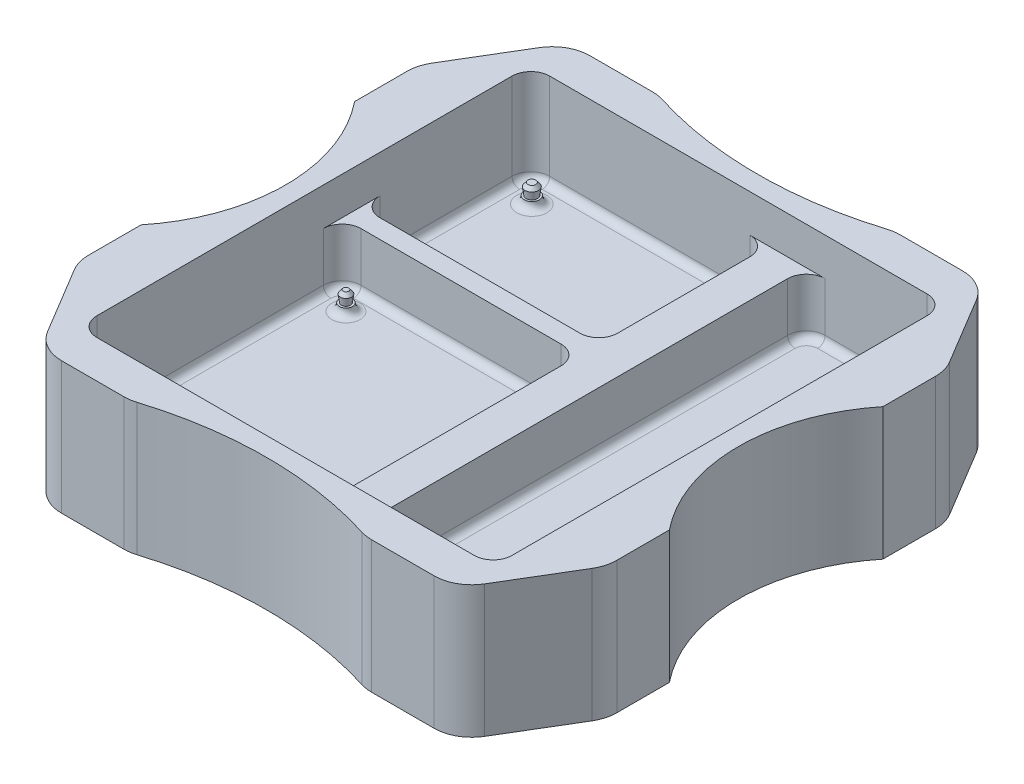
from build123d import *
from OCP.BRepFilletAPI import BRepFilletAPI_MakeChamfer

# Parameters (mm, degrees)
SKETCH1_W                     = 140
SKETCH1_H                     = 140
BOSS_EXTRUDE1_DEPTH           = 40
SHELL3_T                      = -10
SKETCH3_W                     = 5
SKETCH3_H                     = 120
BOSS_EXTRUDE2_DEPTH           = 30
CUT_EXTRUDE1_DEPTH            = 40
FILLET1_R                     = 10
SKETCH5_R                     = 45
SKETCH5_R_2                   = 100
CUT_EXTRUDE4_DEPTH            = 40
FILLET2_R                     = 10
SKETCH6_W                     = 63
SKETCH6_H                     = 5
BOSS_EXTRUDE3_DEPTH           = 15
FILLET4_R                     = 5
SKETCH7_R                     = 1.75
SKETCH7_R_2                   = 2
BOSS_EXTRUDE4_DEPTH           = 2
SKETCH8_R                     = 1.5
BOSS_EXTRUDE5_DEPTH           = 3
BOSS_EXTRUDE5_DRAFT           = -8
BOSS_EXTRUDE5_PROFILE_2_DEPTH = 3
BOSS_EXTRUDE5_PROFILE_2_DRAFT = -8
SKETCH8_R_2                   = 1.2
BOSS_EXTRUDE5_PROFILE_3_DEPTH = 3
BOSS_EXTRUDE5_PROFILE_3_DRAFT = -8
BOSS_EXTRUDE5_PROFILE_4_DEPTH = 3
BOSS_EXTRUDE5_PROFILE_4_DRAFT = -8
BOSS_EXTRUDE5_PROFILE_5_DEPTH = 3
BOSS_EXTRUDE5_PROFILE_5_DRAFT = -8
BOSS_EXTRUDE5_PROFILE_6_DEPTH = 3
BOSS_EXTRUDE5_PROFILE_6_DRAFT = -8
CHAMFER1_SIZE                 = 1
CHAMFER1_SIZE2                = 0.885393615
FILLET7_R                     = 2
CUT_EXTRUDE5_DEPTH            = 5


with BuildPart() as part:
    # Sketch1 → Boss-Extrude1 (new body)
    with BuildSketch(Plane(origin=(0, 0, 0), x_dir=(1, 0, 0), z_dir=(0, 1, 0))):
        with Locations((4.2, -21)):
            Rectangle(SKETCH1_W, SKETCH1_H)
    extrude(amount=BOSS_EXTRUDE1_DEPTH)

    # Shell3
    shell3_openings = [part.faces().sort_by_distance(p)[0] for p in [
        (4.2, 40, 21),
    ]]
    offset(amount=SHELL3_T, openings=shell3_openings, kind=Kind.INTERSECTION)

    # Sketch3 → Boss-Extrude2 (add)
    with BuildSketch(Plane(origin=(0, 10, 0), x_dir=(1, 0, 0), z_dir=(0, 1, 0))):
        with Locations((-53.3, -21)):
            Rectangle(SKETCH3_W, SKETCH3_H)
        with Locations((61.7, -21)):
            Rectangle(SKETCH3_W, SKETCH3_H)
    extrude(amount=BOSS_EXTRUDE2_DEPTH)

    # Sketch4 → Cut-Extrude1 (cut)
    with BuildSketch(Plane(origin=(0, 40, 0), x_dir=(1, 0, 0), z_dir=(0, 1, 0))):
        Polygon((-65.8, 24), (-50.8, 49), (-65.8, 49), align=None)
        Polygon((59.2, 49), (74.2, 49), (74.2, 24), align=None)
        Polygon((74.2, -91), (74.2, -66), (59.2, -91), align=None)
        Polygon((-65.8, -66), (-50.8, -91), (-65.8, -91), align=None)
    extrude(amount=-CUT_EXTRUDE1_DEPTH, mode=Mode.SUBTRACT)

    # Fillet1
    fillet1_edges = [part.edges().sort_by_distance(p)[0] for p in [
        (-65.8, 20, -24),
        (-50.8, 20, -49),
        (74.2, 20, -24),
        (59.2, 20, -49),
        (59.2, 20, 91),
        (74.2, 20, 66),
        (-65.8, 20, 66),
        (-50.8, 20, 91),
    ]]
    fillet(fillet1_edges, radius=FILLET1_R)

    # Sketch5 → Cut-Extrude4 (cut)
    with BuildSketch(Plane(origin=(0, 40, 0), x_dir=(1, 0, 0), z_dir=(0, 1, 0))):
        with Locations((-100.8, -21)):
            Circle(SKETCH5_R)
        with Locations((109.2, -21)):
            Circle(SKETCH5_R)
        with Locations((4.2, 144)):
            Circle(SKETCH5_R_2)
        with Locations((4.2, -186)):
            Circle(SKETCH5_R_2)
    extrude(amount=-CUT_EXTRUDE4_DEPTH, mode=Mode.SUBTRACT)

    # Fillet2
    fillet2_edges = [part.edges().sort_by_distance(p)[0] for p in [
        (35.424989992, 20, -49),
        (-27.024989992, 20, -49),
        (-27.024989992, 20, 91),
        (35.424989992, 20, 91),
    ]]
    fillet(fillet2_edges, radius=FILLET2_R)

    # Sketch6 → Boss-Extrude3 (add)
    with BuildSketch(Plane(origin=(0, 10, 0), x_dir=(1, 0, 0), z_dir=(0, 1, 0))):
        with Locations((-19.3, -8.5)):
            Rectangle(SKETCH6_W, SKETCH6_H)
        Polygon((12.2, 39), (12.2, -6), (12.2, -11), (12.2, -81), (22.2, -81), (22.2, 39), align=None)
    extrude(amount=BOSS_EXTRUDE3_DEPTH)

    # Fillet4
    fillet4_edges = [part.edges().sort_by_distance(p)[0] for p in [
        (-50.8, 17.5, 11),
        (12.2, 17.5, 11),
        (12.2, 17.5, 81),
        (22.2, 17.5, 81),
        (22.2, 17.5, -39),
        (12.2, 17.5, -39),
        (12.2, 17.5, 6),
        (-50.8, 17.5, 6),
        (-50.8, 25, 81),
        (-50.8, 25, -39),
        (59.2, 25, -39),
        (59.2, 25, 81),
    ]]
    fillet(fillet4_edges, radius=FILLET4_R)

    # Sketch7 → Boss-Extrude4 (add)
    with BuildSketch(Plane(origin=(0, 10, 0), x_dir=(1, 0, 0), z_dir=(0, 1, 0))):
        with Locations(Location((-43.8, -75, 0), (0, 0, 270))):
            Circle(SKETCH7_R)
        with Locations(Location((5.2, -75, 0), (0, 0, 270))):
            Circle(SKETCH7_R)
        with Locations(Location((-43.8, -17, 0), (0, 0, 270))):
            Circle(SKETCH7_R)
        with Locations(Location((5.2, -16, 0), (0, 0, 270))):
            Circle(SKETCH7_R)
        with Locations(Location((-43.8, 0.75, 0), (0, 0, 270))):
            Circle(SKETCH7_R_2)
        with Locations(Location((-43.8, 32.25, 0), (0, 0, 270))):
            Circle(SKETCH7_R_2)
    extrude(amount=BOSS_EXTRUDE4_DEPTH)


with BuildPart() as boss_extrude5_tool:
    # Sketch8 → Boss-Extrude5 (with draft: the straight prism first)
    with BuildSketch(Plane(origin=(0, 12, 0), x_dir=(1, 0, 0), z_dir=(0, 1, 0))):
        with Locations((-43.8, 32.25)):
            Circle(SKETCH8_R)
    extrude(amount=BOSS_EXTRUDE5_DEPTH)
    # Boss-Extrude5: the draft: its side faces are tilted about the plane it starts from
    boss_extrude5_sides = [boss_extrude5_tool.faces().sort_by_distance(p)[0] for p in [
        (-45.3, 13.5, -32.25),
    ]]
    draft(boss_extrude5_sides, Plane(origin=(0, 12, 0), x_dir=(1, 0, 0), z_dir=(0, 1, 0)), BOSS_EXTRUDE5_DRAFT)


with BuildPart() as part_1:
    add(part.part)

    # Boss-Extrude5: add boss_extrude5_tool
    add(boss_extrude5_tool.part)


with BuildPart() as boss_extrude5_profile_2_tool:
    # Sketch8 → Boss-Extrude5 profile 2 (with draft: the straight prism first)
    with BuildSketch(Plane(origin=(0, 12, 0), x_dir=(1, 0, 0), z_dir=(0, 1, 0))):
        with Locations((-43.8, 0.75)):
            Circle(SKETCH8_R)
    extrude(amount=BOSS_EXTRUDE5_PROFILE_2_DEPTH)
    # Boss-Extrude5 profile 2: the draft: its side faces are tilted about the plane it starts from
    boss_extrude5_profile_2_sides = [boss_extrude5_profile_2_tool.faces().sort_by_distance(p)[0] for p in [
        (-45.3, 13.5, -0.75),
    ]]
    draft(boss_extrude5_profile_2_sides, Plane(origin=(0, 12, 0), x_dir=(1, 0, 0), z_dir=(0, 1, 0)), BOSS_EXTRUDE5_PROFILE_2_DRAFT)


with BuildPart() as part_2:
    add(part_1.part)

    # Boss-Extrude5 profile 2: add boss_extrude5_profile_2_tool
    add(boss_extrude5_profile_2_tool.part)


with BuildPart() as boss_extrude5_profile_3_tool:
    # Sketch8 → Boss-Extrude5 profile 3 (with draft: the straight prism first)
    with BuildSketch(Plane(origin=(0, 12, 0), x_dir=(1, 0, 0), z_dir=(0, 1, 0))):
        with Locations((-43.8, -17)):
            Circle(SKETCH8_R_2)
    extrude(amount=BOSS_EXTRUDE5_PROFILE_3_DEPTH)
    # Boss-Extrude5 profile 3: the draft: its side faces are tilted about the plane it starts from
    boss_extrude5_profile_3_sides = [boss_extrude5_profile_3_tool.faces().sort_by_distance(p)[0] for p in [
        (-45, 13.5, 17),
    ]]
    draft(boss_extrude5_profile_3_sides, Plane(origin=(0, 12, 0), x_dir=(1, 0, 0), z_dir=(0, 1, 0)), BOSS_EXTRUDE5_PROFILE_3_DRAFT)


with BuildPart() as part_3:
    add(part_2.part)

    # Boss-Extrude5 profile 3: add boss_extrude5_profile_3_tool
    add(boss_extrude5_profile_3_tool.part)


with BuildPart() as boss_extrude5_profile_4_tool:
    # Sketch8 → Boss-Extrude5 profile 4 (with draft: the straight prism first)
    with BuildSketch(Plane(origin=(0, 12, 0), x_dir=(1, 0, 0), z_dir=(0, 1, 0))):
        with Locations((5.2, -16)):
            Circle(SKETCH8_R_2)
    extrude(amount=BOSS_EXTRUDE5_PROFILE_4_DEPTH)
    # Boss-Extrude5 profile 4: the draft: its side faces are tilted about the plane it starts from
    boss_extrude5_profile_4_sides = [boss_extrude5_profile_4_tool.faces().sort_by_distance(p)[0] for p in [
        (4, 13.5, 16),
    ]]
    draft(boss_extrude5_profile_4_sides, Plane(origin=(0, 12, 0), x_dir=(1, 0, 0), z_dir=(0, 1, 0)), BOSS_EXTRUDE5_PROFILE_4_DRAFT)


with BuildPart() as part_4:
    add(part_3.part)

    # Boss-Extrude5 profile 4: add boss_extrude5_profile_4_tool
    add(boss_extrude5_profile_4_tool.part)


with BuildPart() as boss_extrude5_profile_5_tool:
    # Sketch8 → Boss-Extrude5 profile 5 (with draft: the straight prism first)
    with BuildSketch(Plane(origin=(0, 12, 0), x_dir=(1, 0, 0), z_dir=(0, 1, 0))):
        with Locations((5.2, -75)):
            Circle(SKETCH8_R_2)
    extrude(amount=BOSS_EXTRUDE5_PROFILE_5_DEPTH)
    # Boss-Extrude5 profile 5: the draft: its side faces are tilted about the plane it starts from
    boss_extrude5_profile_5_sides = [boss_extrude5_profile_5_tool.faces().sort_by_distance(p)[0] for p in [
        (4, 13.5, 75),
    ]]
    draft(boss_extrude5_profile_5_sides, Plane(origin=(0, 12, 0), x_dir=(1, 0, 0), z_dir=(0, 1, 0)), BOSS_EXTRUDE5_PROFILE_5_DRAFT)


with BuildPart() as part_5:
    add(part_4.part)

    # Boss-Extrude5 profile 5: add boss_extrude5_profile_5_tool
    add(boss_extrude5_profile_5_tool.part)


with BuildPart() as boss_extrude5_profile_6_tool:
    # Sketch8 → Boss-Extrude5 profile 6 (with draft: the straight prism first)
    with BuildSketch(Plane(origin=(0, 12, 0), x_dir=(1, 0, 0), z_dir=(0, 1, 0))):
        with Locations((-43.8, -75)):
            Circle(SKETCH8_R_2)
    extrude(amount=BOSS_EXTRUDE5_PROFILE_6_DEPTH)
    # Boss-Extrude5 profile 6: the draft: its side faces are tilted about the plane it starts from
    boss_extrude5_profile_6_sides = [boss_extrude5_profile_6_tool.faces().sort_by_distance(p)[0] for p in [
        (-45, 13.5, 75),
    ]]
    draft(boss_extrude5_profile_6_sides, Plane(origin=(0, 12, 0), x_dir=(1, 0, 0), z_dir=(0, 1, 0)), BOSS_EXTRUDE5_PROFILE_6_DRAFT)


with BuildPart() as part_6:
    add(part_5.part)

    # Boss-Extrude5 profile 6: add boss_extrude5_profile_6_tool
    add(boss_extrude5_profile_6_tool.part)

    # Chamfer1: one chamfer whose edges measure the first distance from different faces: ONE call of the kernel's chamfer builder (chamfer() names one face for all edges)
    chamfer1_edges_1 = [part_6.edges().sort_by_distance(p)[0] for p in [
        (-45.721622504, 15, -32.25),
    ]]
    chamfer1_side_1 = [part_6.faces().sort_by_distance(p)[0] for p in [
        (-45.510811252, 13.5, -32.25),
    ]]
    chamfer1_edges_2 = [part_6.edges().sort_by_distance(p)[0] for p in [
        (-45.721622504, 15, -0.75),
    ]]
    chamfer1_side_2 = [part_6.faces().sort_by_distance(p)[0] for p in [
        (-45.510811252, 13.5, -0.75),
    ]]
    chamfer1_edges_3 = [part_6.edges().sort_by_distance(p)[0] for p in [
        (-45.421622504, 15, 17),
    ]]
    chamfer1_side_3 = [part_6.faces().sort_by_distance(p)[0] for p in [
        (-45.210811252, 13.5, 17),
    ]]
    chamfer1_edges_4 = [part_6.edges().sort_by_distance(p)[0] for p in [
        (3.578377496, 15, 16),
    ]]
    chamfer1_side_4 = [part_6.faces().sort_by_distance(p)[0] for p in [
        (3.789188748, 13.5, 16),
    ]]
    chamfer1_edges_5 = [part_6.edges().sort_by_distance(p)[0] for p in [
        (3.578377496, 15, 75),
    ]]
    chamfer1_side_5 = [part_6.faces().sort_by_distance(p)[0] for p in [
        (3.789188748, 13.5, 75),
    ]]
    chamfer1_edges_6 = [part_6.edges().sort_by_distance(p)[0] for p in [
        (-45.421622504, 15, 75),
    ]]
    chamfer1_side_6 = [part_6.faces().sort_by_distance(p)[0] for p in [
        (-45.210811252, 13.5, 75),
    ]]
    chamfer1 = BRepFilletAPI_MakeChamfer(part_6.part.solid().wrapped)
    for e in chamfer1_edges_1:
        chamfer1.Add(CHAMFER1_SIZE, CHAMFER1_SIZE2, e.wrapped, chamfer1_side_1[0].wrapped)  # the first distance lies on this face
    for e in chamfer1_edges_2:
        chamfer1.Add(CHAMFER1_SIZE, CHAMFER1_SIZE2, e.wrapped, chamfer1_side_2[0].wrapped)  # the first distance lies on this face
    for e in chamfer1_edges_3:
        chamfer1.Add(CHAMFER1_SIZE, CHAMFER1_SIZE2, e.wrapped, chamfer1_side_3[0].wrapped)  # the first distance lies on this face
    for e in chamfer1_edges_4:
        chamfer1.Add(CHAMFER1_SIZE, CHAMFER1_SIZE2, e.wrapped, chamfer1_side_4[0].wrapped)  # the first distance lies on this face
    for e in chamfer1_edges_5:
        chamfer1.Add(CHAMFER1_SIZE, CHAMFER1_SIZE2, e.wrapped, chamfer1_side_5[0].wrapped)  # the first distance lies on this face
    for e in chamfer1_edges_6:
        chamfer1.Add(CHAMFER1_SIZE, CHAMFER1_SIZE2, e.wrapped, chamfer1_side_6[0].wrapped)  # the first distance lies on this face
    add(Compound.cast(chamfer1.Shape()), mode=Mode.REPLACE)

    # Fillet7
    # the kernel refuses this fillet: 2 mm, written as the material it adds along each edge
    with BuildSketch(Plane(origin=(59.2, 10, 76), x_dir=(-1, 0, 0), z_dir=(0, 0, -1))) as fillet7_piece_1:
        with BuildLine():
            CenterArc((FILLET7_R, FILLET7_R), FILLET7_R, 180, 90)
            Line((0, FILLET7_R), (0, 0))
            Line((0, 0), (FILLET7_R, 0))
        make_face()
    extrude(amount=110)
    with BuildSketch(Plane(origin=(22.2, 10, 76), x_dir=(1, 0, 0), z_dir=(0, 0, -1))) as fillet7_piece_2:
        with BuildLine():
            CenterArc((FILLET7_R, -FILLET7_R), FILLET7_R, 90, 90)
            Line((0, -FILLET7_R), (0, 0))
            Line((0, 0), (FILLET7_R, 0))
        make_face()
    extrude(amount=110)
    with BuildSketch(Plane(origin=(27.2, 10, 81), x_dir=(0, 0, -1), z_dir=(1, 0, 0))) as fillet7_piece_3:
        with BuildLine():
            CenterArc((FILLET7_R, FILLET7_R), FILLET7_R, 180, 90)
            Line((0, FILLET7_R), (0, 0))
            Line((0, 0), (FILLET7_R, 0))
        make_face()
    extrude(amount=27)
    with BuildSketch(Plane(origin=(54.2, 10, -39), x_dir=(0, 1, 0), z_dir=(-1, 0, 0))) as fillet7_piece_4:
        with BuildLine():
            CenterArc((FILLET7_R, -FILLET7_R), FILLET7_R, 90, 90)
            Line((0, -FILLET7_R), (0, 0))
            Line((0, 0), (FILLET7_R, 0))
        make_face()
    extrude(amount=27)
    with BuildSketch(Plane(origin=(27.2, 10, 76), x_dir=(0, 0, 1), z_dir=(1, 0, 0))) as fillet7_piece_5:
        with BuildLine():
            CenterArc((5 - FILLET7_R, -FILLET7_R), FILLET7_R, 0, 90)
            Line((5, -FILLET7_R), (5, 0))
            Line((5, 0), (5 - FILLET7_R, 0))
        make_face()
    revolve(axis=Axis((27.2, 10, 76), (0, -1, 0)), revolution_arc=90)
    with BuildSketch(Plane(origin=(54.2, 10, 76), x_dir=(0, 0, 1), z_dir=(-1, 0, 0))) as fillet7_piece_6:
        with BuildLine():
            CenterArc((5 - FILLET7_R, FILLET7_R), FILLET7_R, 270, 90)
            Line((5, FILLET7_R), (5, 0))
            Line((5, 0), (5 - FILLET7_R, 0))
        make_face()
    revolve(axis=Axis((54.2, 10, 76), (0, 1, 0)), revolution_arc=90)
    with BuildSketch(Plane(origin=(27.2, 10, -34), x_dir=(0, 0, -1), z_dir=(1, 0, 0))) as fillet7_piece_7:
        with BuildLine():
            CenterArc((5 - FILLET7_R, FILLET7_R), FILLET7_R, 270, 90)
            Line((5, FILLET7_R), (5, 0))
            Line((5, 0), (5 - FILLET7_R, 0))
        make_face()
    revolve(axis=Axis((27.2, 10, -34), (0, 1, 0)), revolution_arc=90)
    with BuildSketch(Plane(origin=(54.2, 10, -34), x_dir=(0, 0, -1), z_dir=(-1, 0, 0))) as fillet7_piece_8:
        with BuildLine():
            CenterArc((5 - FILLET7_R, -FILLET7_R), FILLET7_R, 0, 90)
            Line((5 - FILLET7_R, 0), (5, 0))
            Line((5, 0), (5, -FILLET7_R))
        make_face()
    revolve(axis=Axis((54.2, 10, -34), (0, -1, 0)), revolution_arc=90)
    with BuildSketch(Plane(origin=(7.2, 10, -39), x_dir=(0, 0, 1), z_dir=(-1, 0, 0)), Plane(origin=(-45.8, 10, 81), x_dir=(0, 0, -1), z_dir=(1, 0, 0))) as fillet7_piece_9:
        with BuildLine():
            CenterArc((FILLET7_R, FILLET7_R), FILLET7_R, 180, 90)
            Line((0, FILLET7_R), (0, 0))
            Line((0, 0), (FILLET7_R, 0))
        make_face()
    extrude(amount=53)
    with BuildSketch(Plane(origin=(12.2, 10, 16), x_dir=(-1, 0, 0), z_dir=(0, 0, 1)), Plane(origin=(-50.8, 10, 16), x_dir=(0, 1, 0), z_dir=(0, 0, 1))) as fillet7_piece_10:
        with BuildLine():
            CenterArc((FILLET7_R, -FILLET7_R), FILLET7_R, 90, 90)
            Line((0, -FILLET7_R), (0, 0))
            Line((0, 0), (FILLET7_R, 0))
        make_face()
    extrude(amount=60)
    with BuildSketch(Plane(origin=(-45.8, 10, 11), x_dir=(0, 0, 1), z_dir=(1, 0, 0)), Plane(origin=(7.2, 10, 6), x_dir=(0, 0, -1), z_dir=(-1, 0, 0))) as fillet7_piece_11:
        with BuildLine():
            CenterArc((FILLET7_R, -FILLET7_R), FILLET7_R, 90, 90)
            Line((0, -FILLET7_R), (0, 0))
            Line((0, 0), (FILLET7_R, 0))
        make_face()
    extrude(amount=53)
    with BuildSketch(Plane(origin=(7.2, 10, 16), x_dir=(0, 0, -1), z_dir=(-1, 0, 0))) as fillet7_piece_12:
        with BuildLine():
            CenterArc((5 - FILLET7_R, -FILLET7_R), FILLET7_R, 0, 90)
            Line((5, -FILLET7_R), (5, 0))
            Line((5, 0), (5 - FILLET7_R, 0))
        make_face()
    revolve(axis=Axis((7.2, 10, 16), (0, -1, 0)), revolution_arc=90)
    with BuildSketch(Plane(origin=(-45.8, 10, 16), x_dir=(-1, 0, 0), z_dir=(0, 0, 1))) as fillet7_piece_13:
        with BuildLine():
            CenterArc((5 - FILLET7_R, -FILLET7_R), FILLET7_R, 0, 90)
            Line((5, -FILLET7_R), (5, 0))
            Line((5, 0), (5 - FILLET7_R, 0))
        make_face()
    revolve(axis=Axis((-45.8, 10, 16), (0, -1, 0)), revolution_arc=90)
    with BuildSketch(Plane(origin=(-45.8, 10, 76), x_dir=(-1, 0, 0), z_dir=(0, 0, -1))) as fillet7_piece_14:
        with BuildLine():
            CenterArc((5 - FILLET7_R, FILLET7_R), FILLET7_R, 270, 90)
            Line((5 - FILLET7_R, 0), (5, 0))
            Line((5, 0), (5, FILLET7_R))
        make_face()
    revolve(axis=Axis((-45.8, 10, 76), (0, 1, 0)), revolution_arc=90)
    with BuildSketch(Plane(origin=(7.2, 10, 76), x_dir=(0, 0, 1), z_dir=(-1, 0, 0))) as fillet7_piece_15:
        with BuildLine():
            CenterArc((5 - FILLET7_R, FILLET7_R), FILLET7_R, 270, 90)
            Line((5, FILLET7_R), (5, 0))
            Line((5, 0), (5 - FILLET7_R, 0))
        make_face()
    revolve(axis=Axis((7.2, 10, 76), (0, 1, 0)), revolution_arc=90)
    with BuildSketch(Plane(origin=(-50.8, 10, -34), x_dir=(1, 0, 0), z_dir=(0, 0, 1))) as fillet7_piece_16:
        with BuildLine():
            CenterArc((FILLET7_R, FILLET7_R), FILLET7_R, 180, 90)
            Line((0, FILLET7_R), (0, 0))
            Line((0, 0), (FILLET7_R, 0))
        make_face()
    extrude(amount=35)
    with BuildSketch(Plane(origin=(12.2, 10, -34), x_dir=(-1, 0, 0), z_dir=(0, 0, 1))) as fillet7_piece_17:
        with BuildLine():
            CenterArc((FILLET7_R, -FILLET7_R), FILLET7_R, 90, 90)
            Line((0, -FILLET7_R), (0, 0))
            Line((0, 0), (FILLET7_R, 0))
        make_face()
    extrude(amount=35)
    with BuildSketch(Plane(origin=(7.2, 10, -34), x_dir=(0, 0, -1), z_dir=(-1, 0, 0))) as fillet7_piece_18:
        with BuildLine():
            CenterArc((5 - FILLET7_R, -FILLET7_R), FILLET7_R, 0, 90)
            Line((5, -FILLET7_R), (5, 0))
            Line((5, 0), (5 - FILLET7_R, 0))
        make_face()
    revolve(axis=Axis((7.2, 10, -34), (0, -1, 0)), revolution_arc=90)
    with BuildSketch(Plane(origin=(-45.8, 10, -34), x_dir=(0, 0, -1), z_dir=(1, 0, 0))) as fillet7_piece_19:
        with BuildLine():
            CenterArc((5 - FILLET7_R, FILLET7_R), FILLET7_R, 270, 90)
            Line((5, FILLET7_R), (5, 0))
            Line((5, 0), (5 - FILLET7_R, 0))
        make_face()
    revolve(axis=Axis((-45.8, 10, -34), (0, 1, 0)), revolution_arc=90)
    with BuildSketch(Plane(origin=(-45.8, 10, 1), x_dir=(-1, 0, 0), z_dir=(0, 0, -1))) as fillet7_piece_20:
        with BuildLine():
            CenterArc((5 - FILLET7_R, FILLET7_R), FILLET7_R, 270, 90)
            Line((5, FILLET7_R), (5, 0))
            Line((5, 0), (5 - FILLET7_R, 0))
        make_face()
    revolve(axis=Axis((-45.8, 10, 1), (0, 1, 0)), revolution_arc=90)
    with BuildSketch(Plane(origin=(7.2, 10, 1), x_dir=(1, 0, 0), z_dir=(0, 0, -1))) as fillet7_piece_21:
        with BuildLine():
            CenterArc((5 - FILLET7_R, -FILLET7_R), FILLET7_R, 0, 90)
            Line((5, -FILLET7_R), (5, 0))
            Line((5, 0), (5 - FILLET7_R, 0))
        make_face()
    revolve(axis=Axis((7.2, 10, 1), (0, -1, 0)), revolution_arc=90)
    with BuildSketch(Plane(origin=(-43.8, 10, 75), x_dir=(0, 0, 1), z_dir=(-1, 0, 0))) as fillet7_piece_22:
        with BuildLine():
            CenterArc((1.75 + FILLET7_R, FILLET7_R), FILLET7_R, 180, 90)
            Line((1.75, FILLET7_R), (1.75, 0))
            Line((1.75, 0), (1.75 + FILLET7_R, 0))
        make_face()
    revolve(axis=Axis((-43.8, 10, 75), (0, 1, 0)))
    with BuildSketch(Plane(origin=(5.2, 10, 75), x_dir=(0, 0, 1), z_dir=(-1, 0, 0))) as fillet7_piece_23:
        with BuildLine():
            CenterArc((1.75 + FILLET7_R, FILLET7_R), FILLET7_R, 180, 90)
            Line((1.75, FILLET7_R), (1.75, 0))
            Line((1.75, 0), (1.75 + FILLET7_R, 0))
        make_face()
    revolve(axis=Axis((5.2, 10, 75), (0, 1, 0)))
    with BuildSketch(Plane(origin=(-43.8, 10, 17), x_dir=(0, 0, 1), z_dir=(-1, 0, 0))) as fillet7_piece_24:
        with BuildLine():
            CenterArc((1.75 + FILLET7_R, FILLET7_R), FILLET7_R, 180, 90)
            Line((1.75, FILLET7_R), (1.75, 0))
            Line((1.75, 0), (1.75 + FILLET7_R, 0))
        make_face()
    revolve(axis=Axis((-43.8, 10, 17), (0, 1, 0)))
    with BuildSketch(Plane(origin=(5.2, 10, 16), x_dir=(0, 0, 1), z_dir=(-1, 0, 0))) as fillet7_piece_25:
        with BuildLine():
            CenterArc((1.75 + FILLET7_R, FILLET7_R), FILLET7_R, 180, 90)
            Line((1.75, FILLET7_R), (1.75, 0))
            Line((1.75, 0), (1.75 + FILLET7_R, 0))
        make_face()
    revolve(axis=Axis((5.2, 10, 16), (0, 1, 0)))
    with BuildSketch(Plane(origin=(-43.8, 10, -0.75), x_dir=(0, 0, 1), z_dir=(-1, 0, 0))) as fillet7_piece_26:
        with BuildLine():
            CenterArc((2 + FILLET7_R, FILLET7_R), FILLET7_R, 180, 90)
            Line((2 + FILLET7_R, 0), (2, 0))
            Line((2, 0), (2, FILLET7_R))
        make_face()
    revolve(axis=Axis((-43.8, 10, -0.75), (0, 1, 0)))
    with BuildSketch(Plane(origin=(-43.8, 10, -32.25), x_dir=(0, 0, 1), z_dir=(-1, 0, 0))) as fillet7_piece_27:
        with BuildLine():
            CenterArc((2 + FILLET7_R, FILLET7_R), FILLET7_R, 180, 90)
            Line((2, FILLET7_R), (2, 0))
            Line((2, 0), (2 + FILLET7_R, 0))
        make_face()
    revolve(axis=Axis((-43.8, 10, -32.25), (0, 1, 0)))

    # Sketch9 → Cut-Extrude5 (cut)
    with BuildSketch(Plane(origin=(0, 40, 0), x_dir=(1, 0, 0), z_dir=(0, 1, 0))):
        Polygon((73.26975164, 76.019868691), (-76.458420342, 76.019868691), (-76.458420342, -104.20986237), (73.26975164, -104.20986237), (73.26975164, -125.728653824), (128.612379706, -125.728653824), (128.612379706, 76.019868691), align=None)
    extrude(amount=-CUT_EXTRUDE5_DEPTH, mode=Mode.SUBTRACT)


solid = part_6.part
